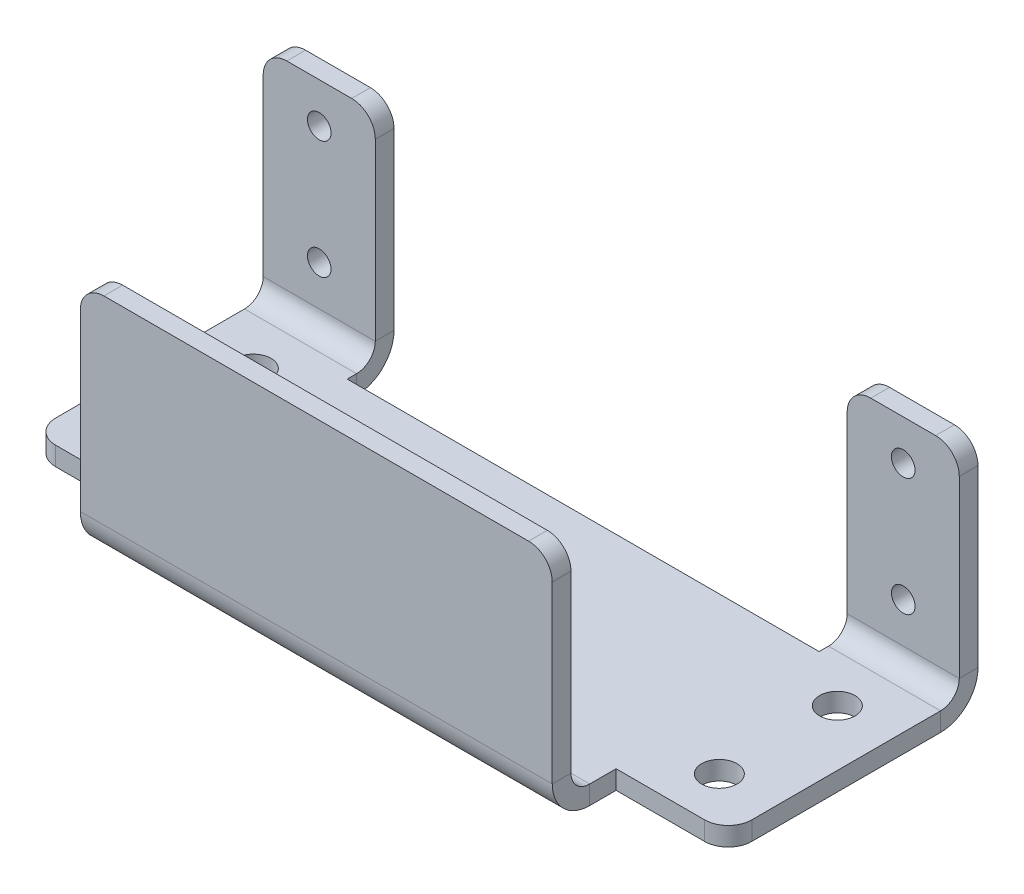
from build123d import *

# Parameters (mm, degrees)
SKETCH2_W                     = 59
SKETCH2_H                     = 25
BOSS_EXTRUDE1_DEPTH           = 1.5875
EDGE_FLANGE2_STRIP_W          = 9.525
EDGE_FLANGE2_STRIP_H          = 1.5875
EDGE_FLANGE2_STRIP_CUT_DEPTH  = 9.5
EDGE_FLANGE2_RELIEF_W         = 10.31875
EDGE_FLANGE2_RELIEF_H         = 0.79375
EDGE_FLANGE2_RELIEF_CUT_DEPTH = 1.5875
EDGE_FLANGE2_DEPTH            = 9.5
EDGE_FLANGE3_STRIP_W          = 9.525
EDGE_FLANGE3_STRIP_H          = 1.5875
EDGE_FLANGE3_STRIP_CUT_DEPTH  = 9.5
EDGE_FLANGE3_RELIEF_W         = 10.31875
EDGE_FLANGE3_RELIEF_H         = 0.79375
EDGE_FLANGE3_RELIEF_CUT_DEPTH = 1.5875
EDGE_FLANGE3_DEPTH            = 9.5
CUT_EXTRUDE1_REACH            = 69.127
SKETCH16_R                    = 1
SKETCH18_W                    = 38.4125
SKETCH18_H                    = 12
BOSS_EXTRUDE2_DEPTH           = 1.5875
SKETCH19_R                    = 1.5
SKETCH19_W                    = 9.5
SKETCH19_H                    = 3.825
CUT_EXTRUDE2_DEPTH            = 1.5875
EDGE_FLANGE4_STRIP_W          = 9.525
EDGE_FLANGE4_STRIP_H          = 1.5875
EDGE_FLANGE4_STRIP_CUT_DEPTH  = 40
EDGE_FLANGE4_DEPTH            = 40
FILLET1_R                     = 2
SKETCH24_W                    = 38.4125
SKETCH24_H                    = 15.96875
CUT_EXTRUDE3_DEPTH            = 10


# Sheet-metal steps are written as plain solids
with BuildPart() as part:
    # Sketch2 → Boss-Extrude1 (new body)
    with BuildSketch(Plane(origin=(0, 0, 0), x_dir=(1, 0, 0), z_dir=(0, 1, 0))):
        with Locations((29.5, 12.5)):
            Rectangle(SKETCH2_W, SKETCH2_H)
    extrude(amount=BOSS_EXTRUDE1_DEPTH)

    # Edge-Flange2 strip (across the edge) → Edge-Flange2 strip cut (cut)
    with BuildSketch(Plane(origin=(59, 1.5875, -25), x_dir=(0, 0, 1), z_dir=(-1, 0, 0))):
        with Locations((-1.5875, -0.79375)):
            Rectangle(EDGE_FLANGE2_STRIP_W, EDGE_FLANGE2_STRIP_H)
    extrude(amount=EDGE_FLANGE2_STRIP_CUT_DEPTH, mode=Mode.SUBTRACT)

    # Edge-Flange2 relief (on the sheet) → Edge-Flange2 relief cut (cut)
    with BuildSketch(Plane(origin=(59, 1.5875, -21.825), x_dir=(0, 0, 1), z_dir=(0, 1, 0))):
        with Locations((-4.365625, -9.896875)):
            Rectangle(EDGE_FLANGE2_RELIEF_W, EDGE_FLANGE2_RELIEF_H)
    extrude(amount=-EDGE_FLANGE2_RELIEF_CUT_DEPTH, mode=Mode.SUBTRACT)

    # Edge-Flange2 section (across the edge) → Edge-Flange2 (add)
    with BuildSketch(Plane(origin=(59, 1.5875, -25), x_dir=(0, 0, 1), z_dir=(-1, 0, 0))):
        with BuildLine():
            Line((0, 1.5875), (0, 18.4125))
            Line((0, 18.4125), (1.5875, 18.4125))
            Line((1.5875, 18.4125), (1.5875, 1.5875))
            ThreePointArc((1.5875, 1.5875), (2.052467985, 0.464967985), (3.175, 0))
            Line((3.175, 0), (3.175, -1.5875))
            ThreePointArc((3.175, -1.5875), (0.92993597, -0.65756403), (0, 1.5875))
        make_face()
    extrude(amount=EDGE_FLANGE2_DEPTH)

    # Edge-Flange3 strip (across the edge) → Edge-Flange3 strip cut (cut)
    with BuildSketch(Plane(origin=(9.5, 1.5875, -25), x_dir=(0, 0, 1), z_dir=(-1, 0, 0))):
        with Locations((-1.5875, -0.79375)):
            Rectangle(EDGE_FLANGE3_STRIP_W, EDGE_FLANGE3_STRIP_H)
    extrude(amount=EDGE_FLANGE3_STRIP_CUT_DEPTH, mode=Mode.SUBTRACT)

    # Edge-Flange3 relief (on the sheet) → Edge-Flange3 relief cut (cut)
    with BuildSketch(Plane(origin=(9.5, 1.5875, -21.825), x_dir=(0, 0, 1), z_dir=(0, 1, 0))):
        with Locations((-4.365625, 0.396875)):
            Rectangle(EDGE_FLANGE3_RELIEF_W, EDGE_FLANGE3_RELIEF_H)
    extrude(amount=-EDGE_FLANGE3_RELIEF_CUT_DEPTH, mode=Mode.SUBTRACT)

    # Edge-Flange3 section (across the edge) → Edge-Flange3 (add)
    with BuildSketch(Plane(origin=(9.5, 1.5875, -25), x_dir=(0, 0, 1), z_dir=(-1, 0, 0))):
        with BuildLine():
            Line((0, 1.5875), (0, 18.4125))
            Line((0, 18.4125), (1.5875, 18.4125))
            Line((1.5875, 18.4125), (1.5875, 1.5875))
            ThreePointArc((1.5875, 1.5875), (2.052467985, 0.464967985), (3.175, 0))
            Line((3.175, 0), (3.175, -1.5875))
            ThreePointArc((3.175, -1.5875), (0.92993597, -0.65756403), (0, 1.5875))
        make_face()
    extrude(amount=EDGE_FLANGE3_DEPTH)

    # Sketch16 → Cut-Extrude1 (cut, up to next)
    with BuildSketch(Plane(origin=(0, 0, -25), x_dir=(-1, 0, 0), z_dir=(0, 0, -1)), mode=Mode.PRIVATE) as cut_extrude1_sk1:
        with Locations(Location((-54.25, 16.5875, 0), (0, 0, 90))):
            Circle(SKETCH16_R)
    cut_extrude1_tool1 = extrude(cut_extrude1_sk1.sketch, amount=-CUT_EXTRUDE1_REACH, mode=Mode.PRIVATE) & part.part
    # Sketch16 → Cut-Extrude1 (cut, up to next)
    with BuildSketch(Plane(origin=(0, 0, -25), x_dir=(-1, 0, 0), z_dir=(0, 0, -1)), mode=Mode.PRIVATE) as cut_extrude1_sk2:
        with Locations(Location((-54.25, 6.5875, 0), (0, 0, 90))):
            Circle(SKETCH16_R)
    cut_extrude1_tool2 = extrude(cut_extrude1_sk2.sketch, amount=-CUT_EXTRUDE1_REACH, mode=Mode.PRIVATE) & part.part
    # Sketch16 → Cut-Extrude1 (cut, up to next)
    with BuildSketch(Plane(origin=(0, 0, -25), x_dir=(-1, 0, 0), z_dir=(0, 0, -1)), mode=Mode.PRIVATE) as cut_extrude1_sk3:
        with Locations(Location((-4.75, 6.5875, 0), (0, 0, 270))):
            Circle(SKETCH16_R)
    cut_extrude1_tool3 = extrude(cut_extrude1_sk3.sketch, amount=-CUT_EXTRUDE1_REACH, mode=Mode.PRIVATE) & part.part
    # Sketch16 → Cut-Extrude1 (cut, up to next)
    with BuildSketch(Plane(origin=(0, 0, -25), x_dir=(-1, 0, 0), z_dir=(0, 0, -1)), mode=Mode.PRIVATE) as cut_extrude1_sk4:
        with Locations(Location((-4.75, 16.5875, 0), (0, 0, 270))):
            Circle(SKETCH16_R)
    cut_extrude1_tool4 = extrude(cut_extrude1_sk4.sketch, amount=-CUT_EXTRUDE1_REACH, mode=Mode.PRIVATE) & part.part
    add(cut_extrude1_tool1.solids().sort_by_distance((54.25, 16.5875, -25))[0], mode=Mode.SUBTRACT)
    add(cut_extrude1_tool2.solids().sort_by_distance((54.25, 6.5875, -25))[0], mode=Mode.SUBTRACT)
    add(cut_extrude1_tool3.solids().sort_by_distance((4.75, 6.5875, -25))[0], mode=Mode.SUBTRACT)
    add(cut_extrude1_tool4.solids().sort_by_distance((4.75, 16.5875, -25))[0], mode=Mode.SUBTRACT)

    # Sketch18 → Boss-Extrude2 (add)
    with BuildSketch(Plane(origin=(0, 1.5875, 0), x_dir=(1, 0, 0), z_dir=(0, 1, 0))):
        with Locations((29.5, 31)):
            Rectangle(SKETCH18_W, SKETCH18_H)
    extrude(amount=-BOSS_EXTRUDE2_DEPTH)

    # Sketch19 → Cut-Extrude2 (cut)
    with BuildSketch(Plane(origin=(0, 1.5875, 0), x_dir=(1, 0, 0), z_dir=(0, 1, 0))):
        with Locations(Location((4.75, 17.825, 0), (0, 0, 270))):
            Circle(SKETCH19_R)
        with Locations(Location((4.75, 7.825, 0), (0, 0, 270))):
            Circle(SKETCH19_R)
        with Locations(Location((54.25, 17.825, 0), (0, 0, 90))):
            Circle(SKETCH19_R)
        with Locations(Location((54.25, 7.825, 0), (0, 0, 90))):
            Circle(SKETCH19_R)
        with Locations((54.25, 1.9125)):
            Rectangle(SKETCH19_W, SKETCH19_H)
        with Locations((4.75, 1.9125)):
            Rectangle(SKETCH19_W, SKETCH19_H)
    extrude(amount=-CUT_EXTRUDE2_DEPTH, mode=Mode.SUBTRACT)

    # Edge-Flange4 strip (across the edge) → Edge-Flange4 strip cut (cut)
    with BuildSketch(Plane(origin=(9.5, 1.5875, 0), x_dir=(0, 0, -1), z_dir=(1, 0, 0))):
        with Locations((-3.175, -0.79375)):
            Rectangle(EDGE_FLANGE4_STRIP_W, EDGE_FLANGE4_STRIP_H)
    extrude(amount=EDGE_FLANGE4_STRIP_CUT_DEPTH, mode=Mode.SUBTRACT)

    # Edge-Flange4 section (across the edge) → Edge-Flange4 (add)
    with BuildSketch(Plane(origin=(9.5, 1.5875, 0), x_dir=(0, 0, -1), z_dir=(1, 0, 0))):
        with BuildLine():
            Line((-1.5875, 1.5875), (-1.5875, 18.4125))
            Line((-1.5875, 18.4125), (0, 18.4125))
            Line((0, 18.4125), (0, 1.5875))
            ThreePointArc((0, 1.5875), (0.464967985, 0.464967985), (1.5875, 0))
            Line((1.5875, 0), (1.5875, -1.5875))
            ThreePointArc((1.5875, -1.5875), (-0.65756403, -0.65756403), (-1.5875, 1.5875))
        make_face()
    extrude(amount=EDGE_FLANGE4_DEPTH)

    # Fillet1
    fillet1_edges = [part.edges().sort_by_distance(p)[0] for p in [
        (10.29375, 0.79375, -37),
        (48.70625, 0.79375, -37),
        (0, 0.79375, -3.825),
        (59, 0.79375, -3.825),
        (9.5, 20, 0.79375),
        (49.5, 20, 0.79375),
        (59, 20, -24.20625),
        (49.5, 20, -24.20625),
        (9.5, 20, -24.20625),
        (0, 20, -24.20625),
    ]]
    fillet(fillet1_edges, radius=FILLET1_R)

    # Sketch24 → Cut-Extrude3 (cut)
    with BuildSketch(Plane(origin=(0, 1.5875, 0), x_dir=(1, 0, 0), z_dir=(0, 1, 0))):
        with Locations((29.5, 29.015625)):
            Rectangle(SKETCH24_W, SKETCH24_H)
    extrude(amount=-CUT_EXTRUDE3_DEPTH, mode=Mode.SUBTRACT)


solid = part.part
